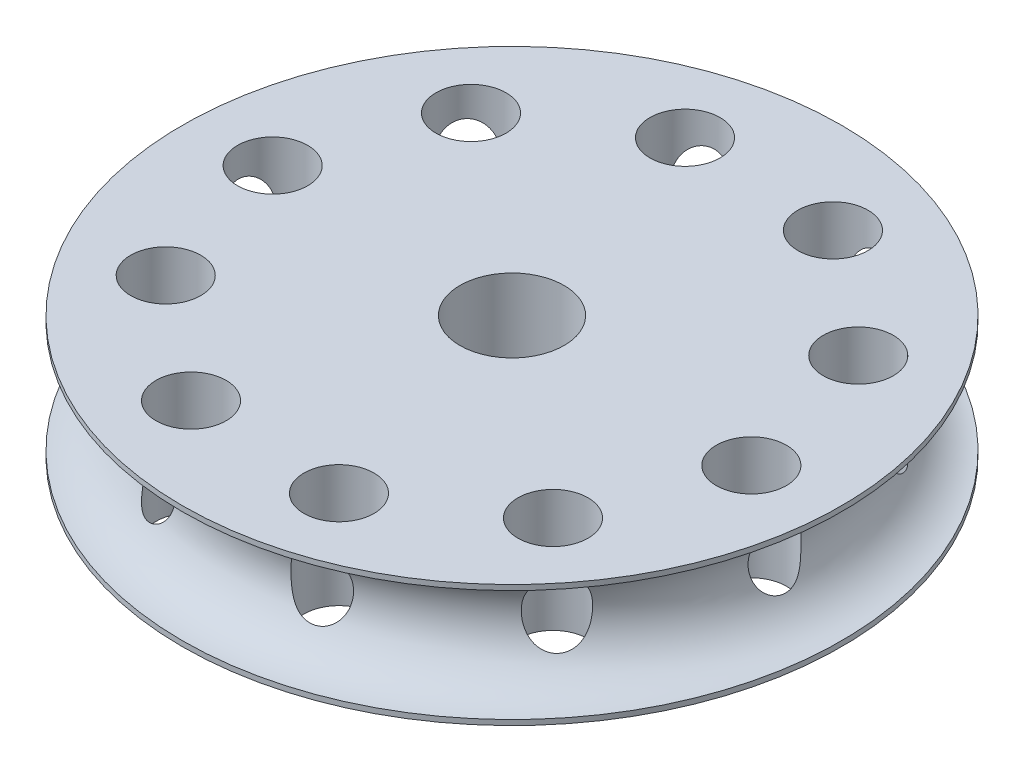
from build123d import *

# Parameters (mm, degrees)
SKETCH1_R           = 97.311105719
BOSS_EXTRUDE1_DEPTH = 18.034
SKETCH2_R           = 15.378422745
SKETCH2_R_2         = 10.351133887
CUT_EXTRUDE1_DEPTH  = 36.068
CIRPATTERN1_COUNT   = 10


# Read off the part's stored shape, not the designer's step: Cut-Revolve-Thin1
with BuildPart() as part:
    # Sketch1 → Boss-Extrude1 (new, symmetric)
    with BuildSketch(Plane(origin=(0, 0, 0), x_dir=(1, 0, 0), z_dir=(0, 1, 0))):
        with Locations(Location((0, 0, 0), (0, 0, 270))):
            Circle(SKETCH1_R)
    extrude(amount=BOSS_EXTRUDE1_DEPTH, both=True)

    # Sketch2 → Cut-Extrude1 (cut)
    with BuildSketch(Plane(origin=(0, 18.034, 0), x_dir=(1, 0, 0), z_dir=(0, 1, 0))):
        with Locations(Location((0, 0, 0), (0, 0, 270))):
            Circle(SKETCH2_R)
        with Locations(Location((-57.840859373, 45.733589908, 0), (0, 0, 270))):
            Circle(SKETCH2_R_2)
    cut_extrude1 = extrude(amount=-CUT_EXTRUDE1_DEPTH, mode=Mode.SUBTRACT)

    # CirPattern1: Cut-Extrude1 ×10 about axis
    cirpattern1_axis = Axis((0, 0, 0), (0, 1, 0))
    for i in range(1, CIRPATTERN1_COUNT):
        add(cut_extrude1.rotate(cirpattern1_axis, i * 360 / CIRPATTERN1_COUNT), mode=Mode.SUBTRACT)

    # Cut-Revolve-Thin1 outline → Cut-Revolve-Thin1 (revolve, cut)
    with BuildSketch(Plane.XY):
        with BuildLine():
            Line((97.311105719, -16.487004203), (97.311105719, 16.487004203))
            ThreePointArc((97.311105719, 16.487004203), (81.211716305, 0), (97.311105719, -16.487004203))
        make_face()
    revolve(axis=Axis((0, 0, 0), (0, 1, 0)), mode=Mode.SUBTRACT)


solid = part.part
